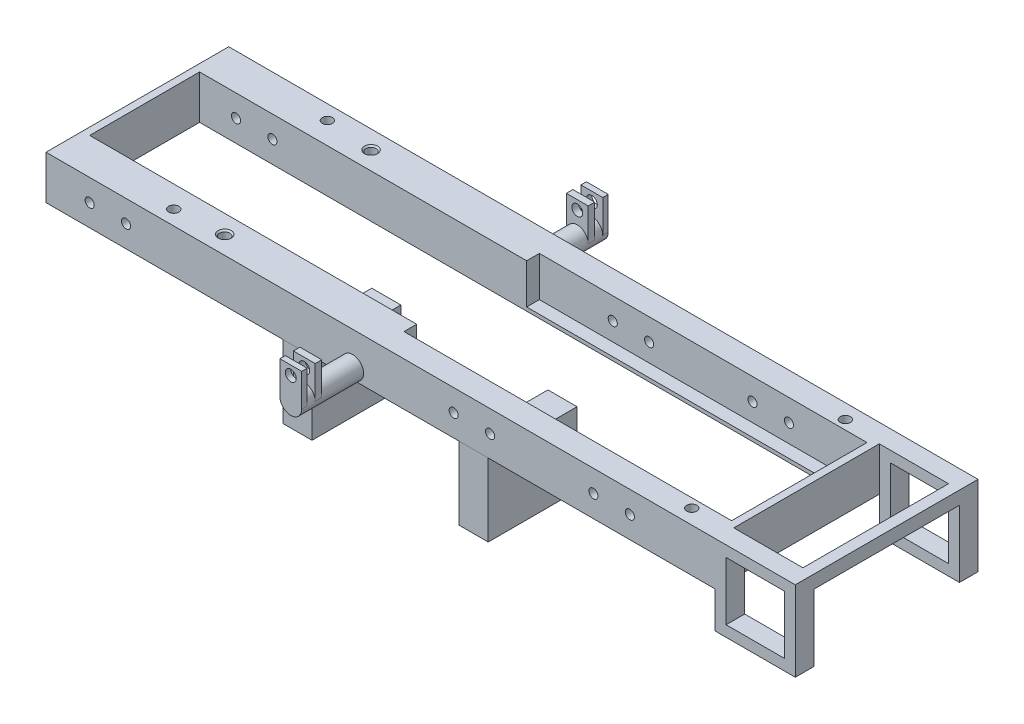
from build123d import *

# Parameters (mm, degrees)
SKETCH_2_W                   = 250
SKETCH_2_H                   = 50.2
SKETCH_2_W_2                 = 246
SKETCH_2_H_2                 = 30.2
EXTRUDE_1_DEPTH              = 12
SKETCH_3_R                   = 1.25
CUT_EXTRUDE_1_DEPTH          = 145.530412025
SKETCH_18_W                  = 8
SKETCH_18_H                  = 20
EXTRUDE_3_DEPTH              = 24.4
EXTRUDE_3_2_DEPTH            = 24.4
SKETCH_20_W                  = 90
SKETCH_20_H                  = 11
CUT_EXTRUDE_6_DEPTH          = 3.5
SKETCH_31_R                  = 1.25
CUT_EXTRUDE_14_DEPTH         = 5
SKETCH_34_R                  = 1.5
CUT_EXTRUDE_15_DEPTH         = 5
SKETCH_35_R                  = 1.4
CUT_EXTRUDE_16_DEPTH         = 143.794829877
CHAMFER_1_SIZE               = 0.4
SKETCH_51_W                  = 2
SKETCH_51_H                  = 12
EXTRUDE_10_DEPTH             = 32
SKETCH_52_W                  = 22
SKETCH_52_H                  = 22
EXTRUDE_11_DEPTH             = 50.2
CUT_EXTRUDE_26_DEPTH         = 20
CUT_EXTRUDE_26_DEPTH_BACK    = 20
SKETCH_60_W                  = 22
SKETCH_60_H                  = 22
CUT_EXTRUDE_27_DEPTH         = 42
CUT_EXTRUDE_27_DEPTH_BACK    = 31
SKETCH_61_W                  = 16
SKETCH_61_H                  = 16
SKETCH_63_W                  = 3
SKETCH_63_H                  = 3.606218164
EXTRUDE_12_DEPTH             = 47
SKETCH_64_W                  = 50.2
SKETCH_64_H                  = 12
CUT_EXTRUDE_28_DEPTH         = 50
SKETCH_66_W                  = 50.2
SKETCH_66_H                  = 12
EXTRUDE_13_DEPTH             = 2
SKETCH_67_R                  = 1.5
CUT_EXTRUDE_29_DEPTH         = 8
SKETCH_69_R                  = 3
EXTRUDE_15_DEPTH             = 17
EXTRUDE_START                = 17
SKETCH_70_R                  = 3
EXTRUDE_16_DEPTH             = 17
EXTRUDE_START_2              = -4.5
EXTRUDE_17_DEPTH             = 4.5
CUT_EXTRUDE_START            = -2.7
CUT_EXTRUDE_31_DEPTH         = 2.7
EXTRUDE_START_3              = -1.5
EXTRUDE_18_DEPTH             = 1.5
EXTRUDE_19_DEPTH             = 4.5
CUT_EXTRUDE_32_DEPTH         = 2.7
EXTRUDE_20_DEPTH             = 1.5
SKETCH_80_W                  = 6
SKETCH_80_H                  = 1
CUT_EXTRUDE_34_DEPTH         = 10
CUT_EXTRUDE_38_DEPTH         = 10
CUT_EXTRUDE_38_DEPTH_BACK    = 10
SKETCH_82_R                  = 1.4
SPLIT_BODIES_1_OUTLINE_R     = 1.4
SPLIT_BODIES_1_OUTLINE_W     = 3
SPLIT_BODIES_1_OUTLINE_H     = 5.1
SPLIT_BODIES_1_DEPTH         = 12
SPLIT_START                  = 9
SPLIT_BODIES_1_2_OUTLINE_W   = 16
SPLIT_BODIES_1_2_OUTLINE_H   = 5.1
SPLIT_BODIES_1_2_OUTLINE_W_2 = 3
SPLIT_BODIES_1_2_OUTLINE_H_2 = 40
SPLIT_BODIES_1_2_DEPTH       = 3
SPLIT_START_2                = -10
SPLIT_BODIES_1_3_OUTLINE_W   = 22
SPLIT_BODIES_1_3_OUTLINE_H   = 5.1
SPLIT_BODIES_1_3_DEPTH       = 3
SPLIT_BODIES_1_4_OUTLINE_W   = 90
SPLIT_BODIES_1_4_OUTLINE_H   = 3.5
SPLIT_BODIES_1_4_DEPTH       = 1
SPLIT_START_3                = -7
SPLIT_BODIES_1_5_OUTLINE_W   = 3
SPLIT_BODIES_1_5_OUTLINE_H   = 5.1
SPLIT_BODIES_1_5_DEPTH       = 7
SPLIT_START_4                = 8.393781836
SPLIT_BODIES_1_6_OUTLINE_W   = 3
SPLIT_BODIES_1_6_OUTLINE_H   = 40
SPLIT_BODIES_1_6_DEPTH       = 0.606218164
SPLIT_START_5                = -33.784070796
SPLIT_BODIES_1_23_OUTLINE_R  = 1.25
SPLIT_BODIES_1_23_OUTLINE_W  = 16
SPLIT_BODIES_1_23_OUTLINE_H  = 16
SPLIT_BODIES_1_23_DEPTH      = 67.2
SPLIT_START_6                = 16.415929204
SPLIT_BODIES_1_24_OUTLINE_R  = 3
SPLIT_BODIES_1_24_DEPTH      = 17
SPLIT_START_7                = 28.915929204
SPLIT_BODIES_1_25_DEPTH      = 1.8
SPLIT_START_8                = 31.915929204
SPLIT_BODIES_1_26_DEPTH      = 1.5
SKETCH_86_W                  = 6
SKETCH_86_H                  = 1.5
SKETCH_86_H_2                = 1.8
EXTRUDE_21_DEPTH             = 4.5
SKETCH_87_R                  = 1.5
CUT_EXTRUDE_39_DEPTH         = 5
SKETCH_88_R                  = 1.5
CUT_EXTRUDE_40_DEPTH         = 5
SPLIT_BODIES_3_OUTLINE_R     = 1.5
SPLIT_BODIES_3_DEPTH         = 1.8
SPLIT_START_9                = -48.084070796
SPLIT_BODIES_3_2_OUTLINE_R   = 1.5
SPLIT_BODIES_3_2_DEPTH       = 1.8
SPLIT_BODIES_3_3_OUTLINE_R   = 1.5
SPLIT_BODIES_3_3_DEPTH       = 1.8
SPLIT_BODIES_3_4_OUTLINE_R   = 1.5
SPLIT_BODIES_3_4_DEPTH       = 1.8
MOVE_START                   = 16.415929204
MOVE_BODY_8_OUTLINE_R        = 3
MOVE_BODY_8_DEPTH            = 17
MOVE_START_2                 = 31.915929204
MOVE_BODY_8_2_OUTLINE_R      = 1.5
MOVE_BODY_8_2_DEPTH          = 1.5
MOVE_START_3                 = 27.915929204
MOVE_BODY_8_3_OUTLINE_R      = 1.5
MOVE_BODY_8_3_DEPTH          = 1.8
MOVE_START_4                 = -47.084070796
MOVE_BODY_8_4_OUTLINE_R      = 1.5
MOVE_BODY_8_4_DEPTH          = 1.8
MOVE_START_5                 = -50.784070796
MOVE_BODY_8_5_OUTLINE_R      = 3
MOVE_BODY_8_5_DEPTH          = 17
MOVE_BODY_8_6_OUTLINE_R      = 1.5
MOVE_BODY_8_6_DEPTH          = 1.5
F_1MM_START                  = -35
F_1MM_DEPTH                  = 52
F_1MM_START_2                = -33.784070796
F_1MM_2_DEPTH                = 6.5
F_1MM_START_3                = 9.915929204
F_1MM_3_DEPTH                = 6.5


with BuildPart() as part:
    # 草图2 → 凸台-拉伸1 (new body)
    with BuildSketch(Plane(origin=(0, 0, 0), x_dir=(1, 0, 0), z_dir=(0, 1, 0))):
        with Locations((10, 8.684070796)):
            Rectangle(SKETCH_2_W, SKETCH_2_H)
        with Locations((10, 8.684070796)):
            Rectangle(SKETCH_2_W_2, SKETCH_2_H_2, mode=Mode.SUBTRACT)
    extrude(amount=EXTRUDE_1_DEPTH)

    # 草图3 → 切除-拉伸1 (cut, through all)
    with BuildSketch(Plane.XY.offset(16.415929204)):
        with Locations((-55, 6)):
            Circle(SKETCH_3_R)
        with Locations((-45, 6)):
            Circle(SKETCH_3_R)
        with Locations((45, 6)):
            Circle(SKETCH_3_R)
        with Locations((55, 6)):
            Circle(SKETCH_3_R)
        with Locations((82.4, 6)):
            Circle(SKETCH_3_R)
        with Locations((92.4, 6)):
            Circle(SKETCH_3_R)
    extrude(amount=-CUT_EXTRUDE_1_DEPTH, mode=Mode.SUBTRACT)

    # 草图20 → 切除-拉伸6 (cut)
    with BuildSketch(Plane.XY.offset(-23.784070796)):
        with Locations((69.84507486, 6.5)):
            Rectangle(SKETCH_20_W, SKETCH_20_H)
    cut_extrude_6 = extrude(amount=-CUT_EXTRUDE_6_DEPTH, mode=Mode.SUBTRACT)

    # 镜向2: 切除-拉伸6 across plane
    add(cut_extrude_6.mirror(Plane(origin=(0, 0, -8.684070796), x_dir=(1, 0, 0), z_dir=(0, 0, -1))), mode=Mode.SUBTRACT)

    # 草图34 → 切除-拉伸15 (cut)
    with BuildSketch(Plane.ZY.offset(115)):
        with Locations((11.415929204, 6)):
            Circle(SKETCH_34_R)
        with Locations((-28.784070796, 6)):
            Circle(SKETCH_34_R)
    extrude(amount=-CUT_EXTRUDE_15_DEPTH, mode=Mode.SUBTRACT)

    # 草图35 → 切除-拉伸16 (cut, through all)
    with BuildSketch(Plane(origin=(0, 12, 0), x_dir=(1, 0, 0), z_dir=(0, 1, 0))):
        with Locations(Location((-22.907191089, -11.415929204, 0), (0, 0, 270))):
            Circle(SKETCH_35_R)
        with Locations(Location((-22.907191089, 28.784070796, 0), (0, 0, 270))):
            Circle(SKETCH_35_R)
    extrude(amount=-CUT_EXTRUDE_16_DEPTH, mode=Mode.SUBTRACT)

    # 倒角1
    chamfer_1_edges = [part.edges().sort_by_distance(p)[0] for p in [
        (-22.907191089, 12, 10.015929204),
        (-22.907191089, 12, -30.184070796),
    ]]
    chamfer(chamfer_1_edges, length=CHAMFER_1_SIZE)

    # 草图51 → 凸台-拉伸10 (add)
    with BuildSketch(Plane(origin=(0, 0, 6.415929204), x_dir=(-1, 0, 0), z_dir=(0, 0, -1))):
        with Locations((-115.84507486, 6)):
            Rectangle(SKETCH_51_W, SKETCH_51_H)
    extrude(amount=EXTRUDE_10_DEPTH)

    # 草图52 → 凸台-拉伸11 (add)
    with BuildSketch(Plane(origin=(0, 0, -33.784070796), x_dir=(-1, 0, 0), z_dir=(0, 0, -1))):
        with Locations((-127.84507486, 1)):
            Rectangle(SKETCH_52_W, SKETCH_52_H)
    extrude(amount=-EXTRUDE_11_DEPTH)

    # 草图60 → 切除-拉伸26 (cut, two sides: drawn at the far end of the back side and taken through both)
    with BuildSketch(Plane.XY.offset(-8.684070796).offset(-CUT_EXTRUDE_26_DEPTH_BACK)):
        with Locations((127.84507486, 1)):
            Rectangle(SKETCH_60_W, SKETCH_60_H)
    extrude(amount=CUT_EXTRUDE_26_DEPTH + CUT_EXTRUDE_26_DEPTH_BACK, mode=Mode.SUBTRACT)

    # 草图61 → 切除-拉伸27 (cut, two sides: drawn at the far end of the back side and taken through both)
    with BuildSketch(Plane.XY.offset(-8.684070796).offset(-CUT_EXTRUDE_27_DEPTH_BACK)):
        with Locations((127.84507486, 1)):
            Rectangle(SKETCH_61_W, SKETCH_61_H)
    extrude(amount=CUT_EXTRUDE_27_DEPTH + CUT_EXTRUDE_27_DEPTH_BACK, mode=Mode.SUBTRACT)

    # 草图63 → 凸台-拉伸12 (add)
    with BuildSketch(Plane(origin=(0, 0, -33.784070796), x_dir=(-1, 0, 0), z_dir=(0, 0, -1))):
        with Locations((-137.34507486, 10.196890918)):
            Rectangle(SKETCH_63_W, SKETCH_63_H)
    extrude(amount=-EXTRUDE_12_DEPTH)

    # 草图64 → 切除-拉伸28 (cut)
    with BuildSketch(Plane.ZY.offset(115)):
        with Locations((-8.684070796, 6)):
            Rectangle(SKETCH_64_W, SKETCH_64_H)
    extrude(amount=-CUT_EXTRUDE_28_DEPTH, mode=Mode.SUBTRACT)

    # 草图66 → 凸台-拉伸13 (add)
    with BuildSketch(Plane.ZY.offset(65)):
        with Locations((-8.684070796, 6)):
            Rectangle(SKETCH_66_W, SKETCH_66_H)
    extrude(amount=EXTRUDE_13_DEPTH)

    # 草图67 → 切除-拉伸29 (cut)
    with BuildSketch(Plane.ZY.offset(67)):
        with Locations((-28.784070796, 6)):
            Circle(SKETCH_67_R)
        with Locations((11.415929204, 6)):
            Circle(SKETCH_67_R)
    extrude(amount=-CUT_EXTRUDE_29_DEPTH, mode=Mode.SUBTRACT)

    # 草图69 → 凸台-拉伸15 (add)
    with BuildSketch(Plane(origin=(0, 0, -33.784070796), x_dir=(-1, 0, 0), z_dir=(0, 0, -1))):
        with Locations(Location((-19.534680148, 3, 0), (0, 0, 270))):
            Circle(SKETCH_69_R)
    extrude(amount=EXTRUDE_15_DEPTH)

    # 草图70 → 凸台-拉伸16 (add)
    with BuildSketch(Plane.XY.offset(16.415929204).offset(EXTRUDE_START)):
        with Locations(Location((19.534680148, 3, 0), (0, 0, 270))):
            Circle(SKETCH_70_R)
    extrude(amount=-EXTRUDE_16_DEPTH)

    # 草图71 → 凸台-拉伸17 (add)
    with BuildSketch(Plane(origin=(0, 0, -50.784070796), x_dir=(-1, 0, 0), z_dir=(0, 0, -1)).offset(EXTRUDE_START_2)):
        with BuildLine():
            Line((-22.534680148, 3), (-22.534680148, 8.5))
            Line((-22.534680148, 8.5), (-16.534680148, 8.5))
            Line((-16.534680148, 8.5), (-16.534680148, 3))
            ThreePointArc((-16.534680148, 3), (-19.534680148, 6), (-22.534680148, 3))
        make_face()
    extrude(amount=EXTRUDE_17_DEPTH)

    # 草图74 → 切除-拉伸31 (cut)
    with BuildSketch(Plane(origin=(0, 0, -50.784070796), x_dir=(-1, 0, 0), z_dir=(0, 0, -1)).offset(CUT_EXTRUDE_START)):
        with BuildLine():
            Line((-22.534680148, 3), (-22.534680148, 8.5))
            Line((-22.534680148, 8.5), (-16.534680148, 8.5))
            Line((-16.534680148, 8.5), (-16.534680148, 3))
            ThreePointArc((-16.534680148, 3), (-19.534680148, 6), (-22.534680148, 3))
        make_face()
    extrude(amount=CUT_EXTRUDE_31_DEPTH, mode=Mode.SUBTRACT)

    # 草图75 → 凸台-拉伸18 (add)
    with BuildSketch(Plane(origin=(0, 0, -50.784070796), x_dir=(-1, 0, 0), z_dir=(0, 0, -1)).offset(EXTRUDE_START_3)):
        with BuildLine():
            Line((-16.534680148, 3), (-16.534680148, 8.5))
            Line((-16.534680148, 8.5), (-22.534680148, 8.5))
            Line((-22.534680148, 8.5), (-22.534680148, 3))
            ThreePointArc((-22.534680148, 3), (-19.534680148, 6), (-16.534680148, 3))
        make_face()
    extrude(amount=EXTRUDE_18_DEPTH)

    # 草图76 → 凸台-拉伸19 (add)
    with BuildSketch(Plane.XY.offset(33.415929204)):
        with BuildLine():
            Line((16.534680148, 3), (16.534680148, 8.5))
            Line((16.534680148, 8.5), (22.534680148, 8.5))
            Line((22.534680148, 8.5), (22.534680148, 3))
            ThreePointArc((22.534680148, 3), (19.534680148, 6), (16.534680148, 3))
        make_face()
    extrude(amount=-EXTRUDE_19_DEPTH)

    # 草图77 → 切除-拉伸32 (cut)
    with BuildSketch(Plane.XY.offset(33.415929204)):
        with BuildLine():
            Line((16.534680148, 3), (16.534680148, 8.5))
            Line((16.534680148, 8.5), (22.534680148, 8.5))
            Line((22.534680148, 8.5), (22.534680148, 3))
            ThreePointArc((22.534680148, 3), (19.534680148, 6), (16.534680148, 3))
        make_face()
    extrude(amount=-CUT_EXTRUDE_32_DEPTH, mode=Mode.SUBTRACT)

    # 草图78 → 凸台-拉伸20 (add)
    with BuildSketch(Plane.XY.offset(33.415929204)):
        with BuildLine():
            Line((16.534680148, 3), (16.534680148, 8.5))
            Line((16.534680148, 8.5), (22.534680148, 8.5))
            Line((22.534680148, 8.5), (22.534680148, 3))
            ThreePointArc((22.534680148, 3), (19.534680148, 6), (16.534680148, 3))
        make_face()
    extrude(amount=-EXTRUDE_20_DEPTH)

    # 草图80 → 切除-拉伸34 (cut)
    with BuildSketch(Plane(origin=(0, 0, -50.784070796), x_dir=(-1, 0, 0), z_dir=(0, 0, -1))):
        with Locations((-19.534680148, 8)):
            Rectangle(SKETCH_80_W, SKETCH_80_H)
    extrude(amount=-CUT_EXTRUDE_34_DEPTH, mode=Mode.SUBTRACT)

    # 草图82 → 切除-拉伸38 (cut, two sides: drawn at the far end of the back side and taken through both)
    with BuildSketch(Plane(origin=(0, 6, 0), x_dir=(-1, 0, 0), z_dir=(0, -1, 0)).offset(-CUT_EXTRUDE_38_DEPTH_BACK)):
        with Locations(Location((-106.4, -12.415929204, 0), (0, 0, 270))):
            Circle(SKETCH_82_R)
        with Locations(Location((-106.4, 29.784070796, 0), (0, 0, 270))):
            Circle(SKETCH_82_R)
        with Locations(Location((35.907191089, 29.784070796, 0), (0, 0, 270))):
            Circle(SKETCH_82_R)
        with Locations(Location((35.907191089, -12.415929204, 0), (0, 0, 270))):
            Circle(SKETCH_82_R)
    extrude(amount=CUT_EXTRUDE_38_DEPTH + CUT_EXTRUDE_38_DEPTH_BACK, mode=Mode.SUBTRACT)

    # Split Bodies 1 23 outline → Split Bodies 1 23 (cut)
    with BuildSketch(Plane.XY.offset(SPLIT_START_5)):
        Polygon((116.84507486, 0), (116.84507486, -10), (138.84507486, -10), (138.84507486, 12), (-67, 12), (-67, 0), align=None)
        with Locations((-55, 6)):
            Circle(SPLIT_BODIES_1_23_OUTLINE_R, mode=Mode.SUBTRACT)
        with Locations((-45, 6)):
            Circle(SPLIT_BODIES_1_23_OUTLINE_R, mode=Mode.SUBTRACT)
        with Locations((82.4, 6)):
            Circle(SPLIT_BODIES_1_23_OUTLINE_R, mode=Mode.SUBTRACT)
        with Locations((92.4, 6)):
            Circle(SPLIT_BODIES_1_23_OUTLINE_R, mode=Mode.SUBTRACT)
        with Locations((45, 6)):
            Circle(SPLIT_BODIES_1_23_OUTLINE_R, mode=Mode.SUBTRACT)
        with Locations((55, 6)):
            Circle(SPLIT_BODIES_1_23_OUTLINE_R, mode=Mode.SUBTRACT)
        with Locations((127.84507486, 1)):
            Rectangle(SPLIT_BODIES_1_23_OUTLINE_W, SPLIT_BODIES_1_23_OUTLINE_H, mode=Mode.SUBTRACT)
    extrude(amount=SPLIT_BODIES_1_23_DEPTH, mode=Mode.SUBTRACT)


with BuildPart() as body_2:
    # 草图18 → 凸台-拉伸3 (new body)
    with BuildSketch(Plane.XY.offset(16.415929204)):
        with Locations((50.492808911, -10)):
            Rectangle(SKETCH_18_W, SKETCH_18_H)
    extrude(amount=-EXTRUDE_3_DEPTH)


with BuildPart() as body_3:
    # 草图18 → Extrude 3 2 (new body)
    with BuildSketch(Plane.XY.offset(16.415929204)):
        with Locations((2.092808911, -10)):
            Rectangle(SKETCH_18_W, SKETCH_18_H)
    extrude(amount=-EXTRUDE_3_2_DEPTH)


with BuildPart() as cut_extrude_14_tool:
    # 草图31 → 切除-拉伸14 (new body)
    with BuildSketch(Plane(origin=(0, 0, -7.984070796), x_dir=(-1, 0, 0), z_dir=(0, 0, -1))):
        with Locations((-2.092808911, -5)):
            Circle(SKETCH_31_R)
        with Locations((-2.092808911, -15)):
            Circle(SKETCH_31_R)
        with Locations((-50.492808911, -5)):
            Circle(SKETCH_31_R)
        with Locations((-50.492808911, -15)):
            Circle(SKETCH_31_R)
    extrude(amount=-CUT_EXTRUDE_14_DEPTH)


with BuildPart() as body_2_1:
    add(body_2.part)

    # 切除-拉伸14: cut by cut_extrude_14_tool
    add(cut_extrude_14_tool.part, mode=Mode.SUBTRACT)


with BuildPart() as body_3_1:
    add(body_3.part)

    # 切除-拉伸14: cut by cut_extrude_14_tool
    add(cut_extrude_14_tool.part, mode=Mode.SUBTRACT)


with BuildPart() as body_4:
    # Split Bodies 1: read off the stored shape, not the designer's step
    # Split Bodies 1 outline → Split Bodies 1 (new body)
    # profile 1 of 3: a face of its own
    with BuildSketch(Plane(origin=(0, 0, 0), x_dir=(1, 0, 0), z_dir=(0, 1, 0))):
        Polygon((119.84507486, -11.315929204), (116.84507486, -11.315929204), (116.84507486, 28.684070796), (119.84507486, 28.684070796), (119.84507486, 33.784070796), (-67, 33.784070796), (-67, -16.415929204), (119.84507486, -16.415929204), align=None)
        with Locations((-35.907191089, -12.415929204)):
            Circle(SPLIT_BODIES_1_OUTLINE_R, mode=Mode.SUBTRACT)
        with Locations((-22.907191089, -11.415929204)):
            Circle(SPLIT_BODIES_1_OUTLINE_R, mode=Mode.SUBTRACT)
        with Locations((106.4, -12.415929204)):
            Circle(SPLIT_BODIES_1_OUTLINE_R, mode=Mode.SUBTRACT)
        Polygon((114.84507486, -9.915929204), (24.84507486, -9.915929204), (24.84507486, -6.415929204), (-65, -6.415929204), (-65, 23.784070796), (24.84507486, 23.784070796), (24.84507486, 27.284070796), (114.84507486, 27.284070796), align=None, mode=Mode.SUBTRACT)
        with Locations((-35.907191089, 29.784070796)):
            Circle(SPLIT_BODIES_1_OUTLINE_R, mode=Mode.SUBTRACT)
        with Locations((-22.907191089, 28.784070796)):
            Circle(SPLIT_BODIES_1_OUTLINE_R, mode=Mode.SUBTRACT)
        with Locations((106.4, 29.784070796)):
            Circle(SPLIT_BODIES_1_OUTLINE_R, mode=Mode.SUBTRACT)
    # profile 2 of 3: a face of its own
    with BuildSketch(Plane(origin=(0, 0, 0), x_dir=(1, 0, 0), z_dir=(0, 1, 0))):
        with Locations((137.34507486, -13.865929204)):
            Rectangle(SPLIT_BODIES_1_OUTLINE_W, SPLIT_BODIES_1_OUTLINE_H)
    # profile 3 of 3: a face of its own
    with BuildSketch(Plane(origin=(0, 0, 0), x_dir=(1, 0, 0), z_dir=(0, 1, 0))):
        with Locations((137.34507486, 31.234070796)):
            Rectangle(SPLIT_BODIES_1_OUTLINE_W, SPLIT_BODIES_1_OUTLINE_H)
    extrude(amount=SPLIT_BODIES_1_DEPTH)

    # Split Bodies 1 2 outline → Split Bodies 1 2 (add)
    with BuildSketch(Plane(origin=(0, 0, 0), x_dir=(1, 0, 0), z_dir=(0, 1, 0)).offset(SPLIT_START)):
        with Locations((127.84507486, -13.865929204)):
            Rectangle(SPLIT_BODIES_1_2_OUTLINE_W, SPLIT_BODIES_1_2_OUTLINE_H)
        with Locations((127.84507486, 31.234070796)):
            Rectangle(SPLIT_BODIES_1_2_OUTLINE_W, SPLIT_BODIES_1_2_OUTLINE_H)
        with Locations((137.34507486, 8.684070796)):
            Rectangle(SPLIT_BODIES_1_2_OUTLINE_W_2, SPLIT_BODIES_1_2_OUTLINE_H_2)
    extrude(amount=SPLIT_BODIES_1_2_DEPTH)

    # Split Bodies 1 3 outline → Split Bodies 1 3 (add)
    with BuildSketch(Plane(origin=(0, 0, 0), x_dir=(1, 0, 0), z_dir=(0, 1, 0)).offset(SPLIT_START_2)):
        with Locations((127.84507486, -13.865929204)):
            Rectangle(SPLIT_BODIES_1_3_OUTLINE_W, SPLIT_BODIES_1_3_OUTLINE_H)
        with Locations((127.84507486, 31.234070796)):
            Rectangle(SPLIT_BODIES_1_3_OUTLINE_W, SPLIT_BODIES_1_3_OUTLINE_H)
    extrude(amount=SPLIT_BODIES_1_3_DEPTH)

    # Split Bodies 1 4 outline → Split Bodies 1 4 (add)
    with BuildSketch(Plane(origin=(0, 0, 0), x_dir=(1, 0, 0), z_dir=(0, 1, 0))):
        with Locations((69.84507486, -8.165929204)):
            Rectangle(SPLIT_BODIES_1_4_OUTLINE_W, SPLIT_BODIES_1_4_OUTLINE_H)
        with Locations((69.84507486, 25.534070796)):
            Rectangle(SPLIT_BODIES_1_4_OUTLINE_W, SPLIT_BODIES_1_4_OUTLINE_H)
    extrude(amount=SPLIT_BODIES_1_4_DEPTH)

    # Split Bodies 1 5 outline → Split Bodies 1 5 (add)
    with BuildSketch(Plane(origin=(0, 0, 0), x_dir=(1, 0, 0), z_dir=(0, 1, 0)).offset(SPLIT_START_3)):
        with Locations((118.34507486, -13.865929204)):
            Rectangle(SPLIT_BODIES_1_5_OUTLINE_W, SPLIT_BODIES_1_5_OUTLINE_H)
        with Locations((118.34507486, 31.234070796)):
            Rectangle(SPLIT_BODIES_1_5_OUTLINE_W, SPLIT_BODIES_1_5_OUTLINE_H)
        with Locations((137.34507486, -13.865929204)):
            Rectangle(SPLIT_BODIES_1_5_OUTLINE_W, SPLIT_BODIES_1_5_OUTLINE_H)
        with Locations((137.34507486, 31.234070796)):
            Rectangle(SPLIT_BODIES_1_5_OUTLINE_W, SPLIT_BODIES_1_5_OUTLINE_H)
    extrude(amount=SPLIT_BODIES_1_5_DEPTH)

    # Split Bodies 1 6 outline → Split Bodies 1 6 (add)
    with BuildSketch(Plane(origin=(0, 0, 0), x_dir=(1, 0, 0), z_dir=(0, 1, 0)).offset(SPLIT_START_4)):
        with Locations((137.34507486, 8.684070796)):
            Rectangle(SPLIT_BODIES_1_6_OUTLINE_W, SPLIT_BODIES_1_6_OUTLINE_H)
    extrude(amount=SPLIT_BODIES_1_6_DEPTH)

    # Split Bodies 1 7: loft between two sections, ruled curve by curve
    split_bodies_1_7_from = [
        Edge.make_three_point_arc((-59, 6, 12.915929204), (-59, 7.5, 11.415929204), (-59, 6, 9.915929204)),
        Edge.make_three_point_arc((-59, 6, 9.915929204), (-59, 4.5, 11.415929204), (-59, 6, 12.915929204)),
    ]
    split_bodies_1_7_to = [
        Edge.make_three_point_arc((-67, 6, 12.915929204), (-67, 7.5, 11.415929204), (-67, 6, 9.915929204)),
        Edge.make_three_point_arc((-67, 6, 9.915929204), (-67, 4.5, 11.415929204), (-67, 6, 12.915929204)),
    ]
    split_bodies_1_7 = Solid(Shell([*[Face.make_surface_from_curves(split_bodies_1_7_from[k], split_bodies_1_7_to[k]) for k in range(2)], Face(Wire(split_bodies_1_7_from)), Face(Wire(split_bodies_1_7_to))]))
    add(split_bodies_1_7, mode=Mode.SUBTRACT)

    # Split Bodies 1 8: loft between two sections, ruled curve by curve
    split_bodies_1_8_from = [
        Edge.make_three_point_arc((-59, 6, -27.284070796), (-59, 7.5, -28.784070796), (-59, 6, -30.284070796)),
        Edge.make_three_point_arc((-59, 6, -30.284070796), (-59, 4.5, -28.784070796), (-59, 6, -27.284070796)),
    ]
    split_bodies_1_8_to = [
        Edge.make_three_point_arc((-67, 6, -27.284070796), (-67, 7.5, -28.784070796), (-67, 6, -30.284070796)),
        Edge.make_three_point_arc((-67, 6, -30.284070796), (-67, 4.5, -28.784070796), (-67, 6, -27.284070796)),
    ]
    split_bodies_1_8 = Solid(Shell([*[Face.make_surface_from_curves(split_bodies_1_8_from[k], split_bodies_1_8_to[k]) for k in range(2)], Face(Wire(split_bodies_1_8_from)), Face(Wire(split_bodies_1_8_to))]))
    add(split_bodies_1_8, mode=Mode.SUBTRACT)

    # Split Bodies 1 9: loft between two sections, ruled curve by curve
    split_bodies_1_9_from = [
        Edge.make_three_point_arc((-22.907191089, 11.6, -27.384070796), (-21.507191089, 11.6, -28.784070796), (-22.907191089, 11.6, -30.184070796)),
        Edge.make_three_point_arc((-22.907191089, 11.6, -30.184070796), (-24.307191089, 11.6, -28.784070796), (-22.907191089, 11.6, -27.384070796)),
    ]
    split_bodies_1_9_to = [
        Edge.make_three_point_arc((-22.907191089, 12, -26.984070796), (-21.107191089, 12, -28.784070796), (-22.907191089, 12, -30.584070796)),
        Edge.make_three_point_arc((-22.907191089, 12, -30.584070796), (-24.707191089, 12, -28.784070796), (-22.907191089, 12, -26.984070796)),
    ]
    split_bodies_1_9 = Solid(Shell([*[Face.make_surface_from_curves(split_bodies_1_9_from[k], split_bodies_1_9_to[k]) for k in range(2)], Face(Wire(split_bodies_1_9_from)), Face(Wire(split_bodies_1_9_to))]))
    add(split_bodies_1_9, mode=Mode.SUBTRACT)

    # Split Bodies 1 10: loft between two sections, ruled curve by curve
    split_bodies_1_10_from = [
        Edge.make_three_point_arc((-22.907191089, 11.6, 12.815929204), (-21.507191089, 11.6, 11.415929204), (-22.907191089, 11.6, 10.015929204)),
        Edge.make_three_point_arc((-22.907191089, 11.6, 10.015929204), (-24.307191089, 11.6, 11.415929204), (-22.907191089, 11.6, 12.815929204)),
    ]
    split_bodies_1_10_to = [
        Edge.make_three_point_arc((-22.907191089, 12, 13.215929204), (-21.107191089, 12, 11.415929204), (-22.907191089, 12, 9.615929204)),
        Edge.make_three_point_arc((-22.907191089, 12, 9.615929204), (-24.707191089, 12, 11.415929204), (-22.907191089, 12, 13.215929204)),
    ]
    split_bodies_1_10 = Solid(Shell([*[Face.make_surface_from_curves(split_bodies_1_10_from[k], split_bodies_1_10_to[k]) for k in range(2)], Face(Wire(split_bodies_1_10_from)), Face(Wire(split_bodies_1_10_to))]))
    add(split_bodies_1_10, mode=Mode.SUBTRACT)

    # Split Bodies 1 11: loft between two sections, ruled curve by curve
    split_bodies_1_11_from = [
        Edge.make_three_point_arc((46.25, 6, 9.915929204), (45, 7.25, 9.915929204), (43.75, 6, 9.915929204)),
        Edge.make_three_point_arc((43.75, 6, 9.915929204), (45, 4.75, 9.915929204), (46.25, 6, 9.915929204)),
    ]
    split_bodies_1_11_to = [
        Edge.make_three_point_arc((46.25, 6, 16.415929204), (45, 7.25, 16.415929204), (43.75, 6, 16.415929204)),
        Edge.make_three_point_arc((43.75, 6, 16.415929204), (45, 4.75, 16.415929204), (46.25, 6, 16.415929204)),
    ]
    split_bodies_1_11 = Solid(Shell([*[Face.make_surface_from_curves(split_bodies_1_11_from[k], split_bodies_1_11_to[k]) for k in range(2)], Face(Wire(split_bodies_1_11_from)), Face(Wire(split_bodies_1_11_to))]))
    add(split_bodies_1_11, mode=Mode.SUBTRACT)

    # Split Bodies 1 12: loft between two sections, ruled curve by curve
    split_bodies_1_12_from = [
        Edge.make_three_point_arc((46.25, 6, -33.784070796), (45, 7.25, -33.784070796), (43.75, 6, -33.784070796)),
        Edge.make_three_point_arc((43.75, 6, -33.784070796), (45, 4.75, -33.784070796), (46.25, 6, -33.784070796)),
    ]
    split_bodies_1_12_to = [
        Edge.make_three_point_arc((46.25, 6, -27.284070796), (45, 7.25, -27.284070796), (43.75, 6, -27.284070796)),
        Edge.make_three_point_arc((43.75, 6, -27.284070796), (45, 4.75, -27.284070796), (46.25, 6, -27.284070796)),
    ]
    split_bodies_1_12 = Solid(Shell([*[Face.make_surface_from_curves(split_bodies_1_12_from[k], split_bodies_1_12_to[k]) for k in range(2)], Face(Wire(split_bodies_1_12_from)), Face(Wire(split_bodies_1_12_to))]))
    add(split_bodies_1_12, mode=Mode.SUBTRACT)

    # Split Bodies 1 13: loft between two sections, ruled curve by curve
    split_bodies_1_13_from = [
        Edge.make_three_point_arc((56.25, 6, 9.915929204), (55, 7.25, 9.915929204), (53.75, 6, 9.915929204)),
        Edge.make_three_point_arc((53.75, 6, 9.915929204), (55, 4.75, 9.915929204), (56.25, 6, 9.915929204)),
    ]
    split_bodies_1_13_to = [
        Edge.make_three_point_arc((56.25, 6, 16.415929204), (55, 7.25, 16.415929204), (53.75, 6, 16.415929204)),
        Edge.make_three_point_arc((53.75, 6, 16.415929204), (55, 4.75, 16.415929204), (56.25, 6, 16.415929204)),
    ]
    split_bodies_1_13 = Solid(Shell([*[Face.make_surface_from_curves(split_bodies_1_13_from[k], split_bodies_1_13_to[k]) for k in range(2)], Face(Wire(split_bodies_1_13_from)), Face(Wire(split_bodies_1_13_to))]))
    add(split_bodies_1_13, mode=Mode.SUBTRACT)

    # Split Bodies 1 14: loft between two sections, ruled curve by curve
    split_bodies_1_14_from = [
        Edge.make_three_point_arc((56.25, 6, -33.784070796), (55, 7.25, -33.784070796), (53.75, 6, -33.784070796)),
        Edge.make_three_point_arc((53.75, 6, -33.784070796), (55, 4.75, -33.784070796), (56.25, 6, -33.784070796)),
    ]
    split_bodies_1_14_to = [
        Edge.make_three_point_arc((56.25, 6, -27.284070796), (55, 7.25, -27.284070796), (53.75, 6, -27.284070796)),
        Edge.make_three_point_arc((53.75, 6, -27.284070796), (55, 4.75, -27.284070796), (56.25, 6, -27.284070796)),
    ]
    split_bodies_1_14 = Solid(Shell([*[Face.make_surface_from_curves(split_bodies_1_14_from[k], split_bodies_1_14_to[k]) for k in range(2)], Face(Wire(split_bodies_1_14_from)), Face(Wire(split_bodies_1_14_to))]))
    add(split_bodies_1_14, mode=Mode.SUBTRACT)

    # Split Bodies 1 15: loft between two sections, ruled curve by curve
    split_bodies_1_15_from = [
        Edge.make_three_point_arc((83.65, 6, 9.915929204), (82.4, 7.25, 9.915929204), (81.15, 6, 9.915929204)),
        Edge.make_three_point_arc((81.15, 6, 9.915929204), (82.4, 4.75, 9.915929204), (83.65, 6, 9.915929204)),
    ]
    split_bodies_1_15_to = [
        Edge.make_three_point_arc((83.65, 6, 16.415929204), (82.4, 7.25, 16.415929204), (81.15, 6, 16.415929204)),
        Edge.make_three_point_arc((81.15, 6, 16.415929204), (82.4, 4.75, 16.415929204), (83.65, 6, 16.415929204)),
    ]
    split_bodies_1_15 = Solid(Shell([*[Face.make_surface_from_curves(split_bodies_1_15_from[k], split_bodies_1_15_to[k]) for k in range(2)], Face(Wire(split_bodies_1_15_from)), Face(Wire(split_bodies_1_15_to))]))
    add(split_bodies_1_15, mode=Mode.SUBTRACT)

    # Split Bodies 1 16: loft between two sections, ruled curve by curve
    split_bodies_1_16_from = [
        Edge.make_three_point_arc((83.65, 6, -33.784070796), (82.4, 7.25, -33.784070796), (81.15, 6, -33.784070796)),
        Edge.make_three_point_arc((81.15, 6, -33.784070796), (82.4, 4.75, -33.784070796), (83.65, 6, -33.784070796)),
    ]
    split_bodies_1_16_to = [
        Edge.make_three_point_arc((83.65, 6, -27.284070796), (82.4, 7.25, -27.284070796), (81.15, 6, -27.284070796)),
        Edge.make_three_point_arc((81.15, 6, -27.284070796), (82.4, 4.75, -27.284070796), (83.65, 6, -27.284070796)),
    ]
    split_bodies_1_16 = Solid(Shell([*[Face.make_surface_from_curves(split_bodies_1_16_from[k], split_bodies_1_16_to[k]) for k in range(2)], Face(Wire(split_bodies_1_16_from)), Face(Wire(split_bodies_1_16_to))]))
    add(split_bodies_1_16, mode=Mode.SUBTRACT)

    # Split Bodies 1 17: loft between two sections, ruled curve by curve
    split_bodies_1_17_from = [
        Edge.make_three_point_arc((93.65, 6, 9.915929204), (92.4, 7.25, 9.915929204), (91.15, 6, 9.915929204)),
        Edge.make_three_point_arc((91.15, 6, 9.915929204), (92.4, 4.75, 9.915929204), (93.65, 6, 9.915929204)),
    ]
    split_bodies_1_17_to = [
        Edge.make_three_point_arc((93.65, 6, 16.415929204), (92.4, 7.25, 16.415929204), (91.15, 6, 16.415929204)),
        Edge.make_three_point_arc((91.15, 6, 16.415929204), (92.4, 4.75, 16.415929204), (93.65, 6, 16.415929204)),
    ]
    split_bodies_1_17 = Solid(Shell([*[Face.make_surface_from_curves(split_bodies_1_17_from[k], split_bodies_1_17_to[k]) for k in range(2)], Face(Wire(split_bodies_1_17_from)), Face(Wire(split_bodies_1_17_to))]))
    add(split_bodies_1_17, mode=Mode.SUBTRACT)

    # Split Bodies 1 18: loft between two sections, ruled curve by curve
    split_bodies_1_18_from = [
        Edge.make_three_point_arc((93.65, 6, -33.784070796), (92.4, 7.25, -33.784070796), (91.15, 6, -33.784070796)),
        Edge.make_three_point_arc((91.15, 6, -33.784070796), (92.4, 4.75, -33.784070796), (93.65, 6, -33.784070796)),
    ]
    split_bodies_1_18_to = [
        Edge.make_three_point_arc((93.65, 6, -27.284070796), (92.4, 7.25, -27.284070796), (91.15, 6, -27.284070796)),
        Edge.make_three_point_arc((91.15, 6, -27.284070796), (92.4, 4.75, -27.284070796), (93.65, 6, -27.284070796)),
    ]
    split_bodies_1_18 = Solid(Shell([*[Face.make_surface_from_curves(split_bodies_1_18_from[k], split_bodies_1_18_to[k]) for k in range(2)], Face(Wire(split_bodies_1_18_from)), Face(Wire(split_bodies_1_18_to))]))
    add(split_bodies_1_18, mode=Mode.SUBTRACT)

    # Split Bodies 1 19: loft between two sections, ruled curve by curve
    split_bodies_1_19_from = [
        Edge.make_three_point_arc((-53.75, 6, -33.784070796), (-55, 7.25, -33.784070796), (-56.25, 6, -33.784070796)),
        Edge.make_three_point_arc((-56.25, 6, -33.784070796), (-55, 4.75, -33.784070796), (-53.75, 6, -33.784070796)),
    ]
    split_bodies_1_19_to = [
        Edge.make_three_point_arc((-53.75, 6, -23.784070796), (-55, 7.25, -23.784070796), (-56.25, 6, -23.784070796)),
        Edge.make_three_point_arc((-56.25, 6, -23.784070796), (-55, 4.75, -23.784070796), (-53.75, 6, -23.784070796)),
    ]
    split_bodies_1_19 = Solid(Shell([*[Face.make_surface_from_curves(split_bodies_1_19_from[k], split_bodies_1_19_to[k]) for k in range(2)], Face(Wire(split_bodies_1_19_from)), Face(Wire(split_bodies_1_19_to))]))
    add(split_bodies_1_19, mode=Mode.SUBTRACT)

    # Split Bodies 1 20: loft between two sections, ruled curve by curve
    split_bodies_1_20_from = [
        Edge.make_three_point_arc((-53.75, 6, 6.415929204), (-55, 7.25, 6.415929204), (-56.25, 6, 6.415929204)),
        Edge.make_three_point_arc((-56.25, 6, 6.415929204), (-55, 4.75, 6.415929204), (-53.75, 6, 6.415929204)),
    ]
    split_bodies_1_20_to = [
        Edge.make_three_point_arc((-53.75, 6, 16.415929204), (-55, 7.25, 16.415929204), (-56.25, 6, 16.415929204)),
        Edge.make_three_point_arc((-56.25, 6, 16.415929204), (-55, 4.75, 16.415929204), (-53.75, 6, 16.415929204)),
    ]
    split_bodies_1_20 = Solid(Shell([*[Face.make_surface_from_curves(split_bodies_1_20_from[k], split_bodies_1_20_to[k]) for k in range(2)], Face(Wire(split_bodies_1_20_from)), Face(Wire(split_bodies_1_20_to))]))
    add(split_bodies_1_20, mode=Mode.SUBTRACT)

    # Split Bodies 1 21: loft between two sections, ruled curve by curve
    split_bodies_1_21_from = [
        Edge.make_three_point_arc((-43.75, 6, -33.784070796), (-45, 7.25, -33.784070796), (-46.25, 6, -33.784070796)),
        Edge.make_three_point_arc((-46.25, 6, -33.784070796), (-45, 4.75, -33.784070796), (-43.75, 6, -33.784070796)),
    ]
    split_bodies_1_21_to = [
        Edge.make_three_point_arc((-43.75, 6, -23.784070796), (-45, 7.25, -23.784070796), (-46.25, 6, -23.784070796)),
        Edge.make_three_point_arc((-46.25, 6, -23.784070796), (-45, 4.75, -23.784070796), (-43.75, 6, -23.784070796)),
    ]
    split_bodies_1_21 = Solid(Shell([*[Face.make_surface_from_curves(split_bodies_1_21_from[k], split_bodies_1_21_to[k]) for k in range(2)], Face(Wire(split_bodies_1_21_from)), Face(Wire(split_bodies_1_21_to))]))
    add(split_bodies_1_21, mode=Mode.SUBTRACT)

    # Split Bodies 1 22: loft between two sections, ruled curve by curve
    split_bodies_1_22_from = [
        Edge.make_three_point_arc((-43.75, 6, 6.415929204), (-45, 7.25, 6.415929204), (-46.25, 6, 6.415929204)),
        Edge.make_three_point_arc((-46.25, 6, 6.415929204), (-45, 4.75, 6.415929204), (-43.75, 6, 6.415929204)),
    ]
    split_bodies_1_22_to = [
        Edge.make_three_point_arc((-43.75, 6, 16.415929204), (-45, 7.25, 16.415929204), (-46.25, 6, 16.415929204)),
        Edge.make_three_point_arc((-46.25, 6, 16.415929204), (-45, 4.75, 16.415929204), (-43.75, 6, 16.415929204)),
    ]
    split_bodies_1_22 = Solid(Shell([*[Face.make_surface_from_curves(split_bodies_1_22_from[k], split_bodies_1_22_to[k]) for k in range(2)], Face(Wire(split_bodies_1_22_from)), Face(Wire(split_bodies_1_22_to))]))
    add(split_bodies_1_22, mode=Mode.SUBTRACT)

    # 补偿轴安装孔组后移1mm: read off the stored shape, not the designer's step
    # 补偿轴安装孔组后移1mm outline → 补偿轴安装孔组后移1mm (cut)
    with BuildSketch(Plane.XY.offset(F_1MM_START)):
        with BuildLine():
            ThreePointArc((82.9, 4.854356076), (84.65, 6), (82.9, 7.145643924))
            ThreePointArc((82.9, 7.145643924), (83.65, 6), (82.9, 4.854356076))
        make_face()
        with BuildLine():
            ThreePointArc((92.9, 4.854356076), (94.65, 6), (92.9, 7.145643924))
            ThreePointArc((92.9, 7.145643924), (93.65, 6), (92.9, 4.854356076))
        make_face()
    extrude(amount=F_1MM_DEPTH, mode=Mode.SUBTRACT)

    # 1mm 2 outline → 1mm 2 (add)
    with BuildSketch(Plane.XY.offset(F_1MM_START_2)):
        with BuildLine():
            ThreePointArc((82.9, 4.854356076), (82.15, 6), (82.9, 7.145643924))
            ThreePointArc((82.9, 7.145643924), (81.15, 6), (82.9, 4.854356076))
        make_face()
        with BuildLine():
            ThreePointArc((92.9, 4.854356076), (92.15, 6), (92.9, 7.145643924))
            ThreePointArc((92.9, 7.145643924), (91.15, 6), (92.9, 4.854356076))
        make_face()
    extrude(amount=F_1MM_2_DEPTH)

    # 1mm 3 outline → 1mm 3 (add)
    with BuildSketch(Plane.XY.offset(F_1MM_START_3)):
        with BuildLine():
            ThreePointArc((82.9, 4.854356076), (82.15, 6), (82.9, 7.145643924))
            ThreePointArc((82.9, 7.145643924), (81.15, 6), (82.9, 4.854356076))
        make_face()
        with BuildLine():
            ThreePointArc((92.9, 4.854356076), (92.15, 6), (92.9, 7.145643924))
            ThreePointArc((92.9, 7.145643924), (91.15, 6), (92.9, 4.854356076))
        make_face()
    extrude(amount=F_1MM_3_DEPTH)


with BuildPart() as body_5:
    # Split Bodies 1 24 outline → Split Bodies 1 24 (new body)
    with BuildSketch(Plane.XY.offset(SPLIT_START_6)):
        with Locations((19.534680148, 3)):
            Circle(SPLIT_BODIES_1_24_OUTLINE_R)
    extrude(amount=SPLIT_BODIES_1_24_DEPTH)

    # Split Bodies 1 25 outline → Split Bodies 1 25 (add)
    with BuildSketch(Plane.XY.offset(SPLIT_START_7)):
        with BuildLine():
            Line((22.534680148, 3), (22.534680148, 8.5))
            Line((22.534680148, 8.5), (16.534680148, 8.5))
            Line((16.534680148, 8.5), (16.534680148, 3))
            ThreePointArc((16.534680148, 3), (19.534680148, 6), (22.534680148, 3))
        make_face()
    extrude(amount=SPLIT_BODIES_1_25_DEPTH)

    # Split Bodies 1 26 outline → Split Bodies 1 26 (add)
    with BuildSketch(Plane.XY.offset(SPLIT_START_8)):
        with BuildLine():
            Line((22.534680148, 3), (22.534680148, 8.5))
            Line((22.534680148, 8.5), (16.534680148, 8.5))
            Line((16.534680148, 8.5), (16.534680148, 3))
            ThreePointArc((16.534680148, 3), (19.534680148, 6), (22.534680148, 3))
        make_face()
    extrude(amount=SPLIT_BODIES_1_26_DEPTH)


with BuildPart() as body_6:
    # Move Body 1: copy of part
    add(part.part.moved(Location((14, 0, 0))))



with BuildPart() as body_7:
    # Move Body 2: copy of body 5
    add(body_5.part.moved(Location((14, 0, 0))))


with BuildPart() as body_6_1:
    add(body_6.part)

    add(body_7.part)  # 凸台-拉伸21 merges body 7
    # 草图86 → 凸台-拉伸21 (add)
    with BuildSketch(Plane(origin=(0, 7.5, 0), x_dir=(1, 0, 0), z_dir=(0, 1, 0))):
        with Locations((33.534680148, 50.034070796)):
            Rectangle(SKETCH_86_W, SKETCH_86_H)
        with Locations((33.534680148, 47.184070796)):
            Rectangle(SKETCH_86_W, SKETCH_86_H_2)
        with Locations((33.534680148, -29.815929204)):
            Rectangle(SKETCH_86_W, SKETCH_86_H_2)
        with Locations((33.534680148, -32.665929204)):
            Rectangle(SKETCH_86_W, SKETCH_86_H)
    extrude(amount=EXTRUDE_21_DEPTH)

    # 草图87 → 切除-拉伸39 (cut)
    with BuildSketch(Plane.XY.offset(33.415929204)):
        with Locations(Location((33.534680148, 9.5, 0), (0, 0, 180))):
            Circle(SKETCH_87_R)
    extrude(amount=-CUT_EXTRUDE_39_DEPTH, mode=Mode.SUBTRACT)

    # 草图88 → 切除-拉伸40 (cut)
    with BuildSketch(Plane(origin=(0, 0, -50.784070796), x_dir=(-1, 0, 0), z_dir=(0, 0, -1))):
        with Locations((-33.534680148, 9.5)):
            Circle(SKETCH_88_R)
    extrude(amount=-CUT_EXTRUDE_40_DEPTH, mode=Mode.SUBTRACT)


with BuildPart() as body_7_2:
    # Move Body 3: copy of body 6
    add(body_6_1.part.moved(Location((-13.53, 0, 0))))

    # Split Bodies 3: read off the stored shape, not the designer's step
    # Split Bodies 3 outline → Split Bodies 3 (cut)
    with BuildSketch(Plane.XY.offset(SPLIT_START_7)):
        with BuildLine():
            ThreePointArc((17.004680148, 3), (20.004680148, 6), (23.004680148, 3))
            Line((23.004680148, 3), (23.004680148, 12))
            Line((23.004680148, 12), (17.004680148, 12))
            Line((17.004680148, 12), (17.004680148, 3))
        make_face()
        with Locations((20.004680148, 9.5)):
            Circle(SPLIT_BODIES_3_OUTLINE_R, mode=Mode.SUBTRACT)
    extrude(amount=SPLIT_BODIES_3_DEPTH, mode=Mode.SUBTRACT)

    # Split Bodies 3 2 outline → Split Bodies 3 2 (cut)
    with BuildSketch(Plane.XY.offset(SPLIT_START_9)):
        with BuildLine():
            Line((23.004680148, 12), (17.004680148, 12))
            Line((17.004680148, 12), (17.004680148, 3))
            ThreePointArc((17.004680148, 3), (20.004680148, 6), (23.004680148, 3))
            Line((23.004680148, 3), (23.004680148, 12))
        make_face()
        with Locations((20.004680148, 9.5)):
            Circle(SPLIT_BODIES_3_2_OUTLINE_R, mode=Mode.SUBTRACT)
    extrude(amount=SPLIT_BODIES_3_2_DEPTH, mode=Mode.SUBTRACT)


with BuildPart() as body_8:
    # Split Bodies 3 3 outline → Split Bodies 3 3 (new body)
    with BuildSketch(Plane.XY.offset(SPLIT_START_7)):
        with BuildLine():
            Line((17.004680148, 12), (17.004680148, 3))
            ThreePointArc((17.004680148, 3), (20.004680148, 6), (23.004680148, 3))
            Line((23.004680148, 3), (23.004680148, 12))
            Line((23.004680148, 12), (17.004680148, 12))
        make_face()
        with Locations((20.004680148, 9.5)):
            Circle(SPLIT_BODIES_3_3_OUTLINE_R, mode=Mode.SUBTRACT)
    extrude(amount=SPLIT_BODIES_3_3_DEPTH)


with BuildPart() as body_9:
    # Split Bodies 3 4 outline → Split Bodies 3 4 (new body)
    with BuildSketch(Plane.XY.offset(SPLIT_START_9)):
        with BuildLine():
            Line((17.004680148, 12), (17.004680148, 3))
            ThreePointArc((17.004680148, 3), (20.004680148, 6), (23.004680148, 3))
            Line((23.004680148, 3), (23.004680148, 12))
            Line((23.004680148, 12), (17.004680148, 12))
        make_face()
        with Locations((20.004680148, 9.5)):
            Circle(SPLIT_BODIES_3_4_OUTLINE_R, mode=Mode.SUBTRACT)
    extrude(amount=SPLIT_BODIES_3_4_DEPTH)


with BuildPart() as body_10:
    # Move Body 5: read off the stored shape, not the designer's step
    # Move Body 5: copy of body 9
    add(body_9.part.moved(Location((0, 0, 1))))


with BuildPart() as body_11:
    # Move Body 6: copy of body 8
    add(body_8.part.moved(Location((0, 0, -1))))


with BuildPart() as body_12:
    # Move Body 8: read off the stored shape, not the designer's step
    # Move Body 8 outline → Move Body 8 (new body)
    with BuildSketch(Plane.XY.offset(MOVE_START)):
        with Locations((14.004680148, 3)):
            Circle(MOVE_BODY_8_OUTLINE_R)
    extrude(amount=MOVE_BODY_8_DEPTH)

    # Move Body 8 2 outline → Move Body 8 2 (add)
    with BuildSketch(Plane.XY.offset(MOVE_START_2)):
        with BuildLine():
            Line((17.004680148, 12), (11.004680148, 12))
            Line((11.004680148, 12), (11.004680148, 3))
            ThreePointArc((11.004680148, 3), (14.004680148, 6), (17.004680148, 3))
            Line((17.004680148, 3), (17.004680148, 12))
        make_face()
        with Locations((14.004680148, 9.5)):
            Circle(MOVE_BODY_8_2_OUTLINE_R, mode=Mode.SUBTRACT)
    extrude(amount=MOVE_BODY_8_2_DEPTH)


with BuildPart() as body_13:
    # Move Body 8 3 outline → Move Body 8 3 (new body)
    with BuildSketch(Plane.XY.offset(MOVE_START_3)):
        with BuildLine():
            Line((11.004680148, 12), (11.004680148, 3))
            ThreePointArc((11.004680148, 3), (14.004680148, 6), (17.004680148, 3))
            Line((17.004680148, 3), (17.004680148, 12))
            Line((17.004680148, 12), (11.004680148, 12))
        make_face()
        with Locations((14.004680148, 9.5)):
            Circle(MOVE_BODY_8_3_OUTLINE_R, mode=Mode.SUBTRACT)
    extrude(amount=MOVE_BODY_8_3_DEPTH)


with BuildPart() as body_14:
    # Move Body 8 4 outline → Move Body 8 4 (new body)
    with BuildSketch(Plane.XY.offset(MOVE_START_4)):
        with BuildLine():
            Line((11.004680148, 12), (11.004680148, 3))
            ThreePointArc((11.004680148, 3), (14.004680148, 6), (17.004680148, 3))
            Line((17.004680148, 3), (17.004680148, 12))
            Line((17.004680148, 12), (11.004680148, 12))
        make_face()
        with Locations((14.004680148, 9.5)):
            Circle(MOVE_BODY_8_4_OUTLINE_R, mode=Mode.SUBTRACT)
    extrude(amount=MOVE_BODY_8_4_DEPTH)


with BuildPart() as body_15:
    # Move Body 8 5 outline → Move Body 8 5 (new body)
    with BuildSketch(Plane.XY.offset(MOVE_START_5)):
        with Locations((14.004680148, 3)):
            Circle(MOVE_BODY_8_5_OUTLINE_R)
    extrude(amount=MOVE_BODY_8_5_DEPTH)

    # Move Body 8 6 outline → Move Body 8 6 (add)
    with BuildSketch(Plane.XY.offset(MOVE_START_5)):
        with BuildLine():
            Line((17.004680148, 12), (11.004680148, 12))
            Line((11.004680148, 12), (11.004680148, 3))
            ThreePointArc((11.004680148, 3), (14.004680148, 6), (17.004680148, 3))
            Line((17.004680148, 3), (17.004680148, 12))
        make_face()
        with Locations((14.004680148, 9.5)):
            Circle(MOVE_BODY_8_6_OUTLINE_R, mode=Mode.SUBTRACT)
    extrude(amount=MOVE_BODY_8_6_DEPTH)


with BuildPart() as body_15_1:
    # Move Body 9: moved
    add(body_15.part.moved(Location((3.25, 0, 0))))


with BuildPart() as body_14_1:
    # Move Body 9: moved
    add(body_14.part.moved(Location((3.25, 0, 0))))


with BuildPart() as body_13_1:
    # Move Body 9: moved
    add(body_13.part.moved(Location((3.25, 0, 0))))


with BuildPart() as body_12_1:
    # Move Body 9: moved
    add(body_12.part.moved(Location((3.25, 0, 0))))


solid = Compound([body_2_1.part, body_3_1.part, body_4.part, body_15_1.part, body_14_1.part, body_13_1.part, body_12_1.part])
